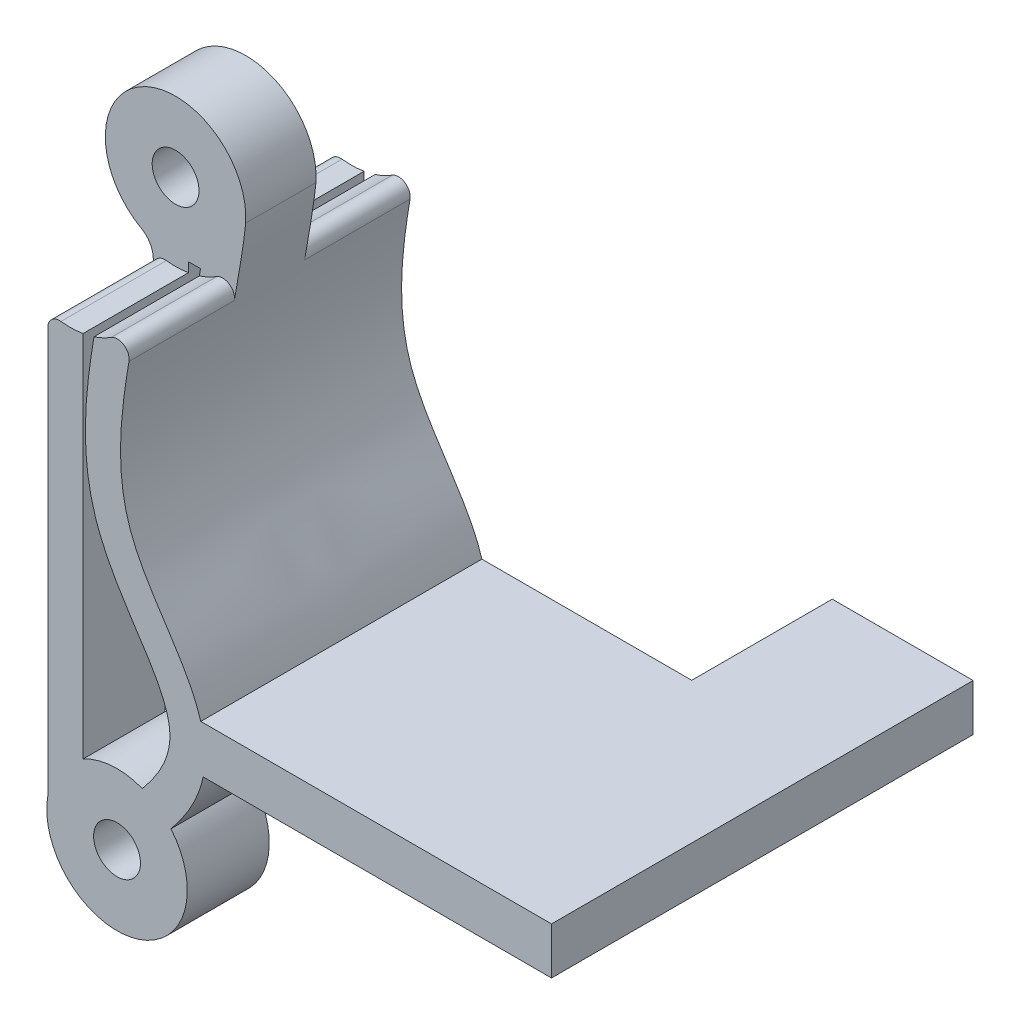
from build123d import *

# Parameters (mm, degrees)
SKETCH1_R               = 1
BOSS_EXTRUDE1_DEPTH     = 12
SKETCH2_R               = 3.3
CUT_EXTRUDE1_DEPTH      = 4.5
CUT_EXTRUDE2_DEPTH      = 2.5
CUT_EXTRUDE2_DEPTH_BACK = 2.5
SKETCH3_R               = 3.3
BOSS_EXTRUDE2_REACH     = 56.558
SKETCH4_W               = 12
SKETCH4_H               = 2
SKETCH5_W               = 6.014002039
SKETCH5_H               = 2
BOSS_EXTRUDE3_DEPTH     = 6
FILLET1_R               = 0.5
FILLET2_R               = 1


with BuildPart() as part:
    # Sketch1 → Boss-Extrude1 (new body)
    with BuildSketch(Plane.XY):
        with BuildLine():
            Line((-2.048815827, 41.884151299), (-2.048815827, 23.656682303))
            ThreePointArc((-2.048815827, 23.656682303), (1.66754925, 20.218418642), (3.205412143, 25.042110601))
            add(Edge.make_bspline(
                [(1.896008332, 44.529660516), (1.616069448, 41.758878479), (-0.936917255, 33.955197005), (6.844694938, 29.417505011), (3.205412143, 25.042110601)],
                knots=[0, 0, 0, 0, 0.461184527, 1, 1, 1, 1], degree=3))
            ThreePointArc((1.896008332, 44.529660516), (-2.768270934, 47.220856283), (-2.048815827, 41.884151299))
        make_face()
        with Locations((-1.097343641, 44.729270045)):
            Circle(SKETCH1_R, mode=Mode.SUBTRACT)
        with Locations((0.902656359, 23.119270045)):
            Circle(SKETCH1_R, mode=Mode.SUBTRACT)
        with BuildLine():
            Line((-0.031319306, 41.884151299), (-0.548815827, 41.884151299))
            Line((-0.548815827, 41.884151299), (-0.548815827, 25.744765902))
            ThreePointArc((-0.548815827, 25.744765902), (0.697826573, 26.112269337), (1.982912704, 25.918028026))
            add(Edge.make_bspline(
                [(-0.031319306, 41.884151299), (-0.050798368, 41.769911378), (-0.110231132, 41.41757497), (-0.243210983, 40.585051968), (-0.402027872, 39.353261852), (-0.479087992, 37.828213551), (-0.375856847, 36.275358456), (0.009969142, 34.681069755), (0.941317901, 32.770668216), (2.035404053, 31.246938586), (2.80471042, 29.909471533), (3.128629571, 29.030940173), (3.19641087, 28.267404516), (3.032335606, 27.550309668), (2.666289508, 26.829120101), (2.334869511, 26.350170873), (2.106769915, 26.067173099), (2.026097439, 25.969974031), (1.996829195, 25.934759382), (1.982912704, 25.918028026)],
                knots=[0.149200089, 0.149200089, 0.149200089, 0.149200089, 0.165683382, 0.19960026, 0.265533433, 0.331466606, 0.397399778, 0.463332951, 0.529266124, 0.661132469, 0.727065642, 0.792998815, 0.858931987, 0.92486516, 0.957831746, 0.990798333, 0.999039979, 1.001358499, 1.00341891, 1.00341891, 1.00341891, 1.00341891], degree=3))
        make_face(mode=Mode.SUBTRACT)
    extrude(amount=BOSS_EXTRUDE1_DEPTH)

    # Sketch2 → Cut-Extrude1 (cut)
    with BuildSketch(Plane.XY.offset(12)):
        with Locations((-1.097343641, 44.729270045)):
            Circle(SKETCH2_R)
    cut_extrude1 = extrude(amount=-CUT_EXTRUDE1_DEPTH, mode=Mode.SUBTRACT)

    # Mirror1: Cut-Extrude1 across plane
    add(cut_extrude1.mirror(Plane.XY.offset(6)), mode=Mode.SUBTRACT)

    # Sketch3 → Cut-Extrude2 (cut, two sides: drawn at the far end of the back side and taken through both)
    with BuildSketch(Plane.XY.offset(6).offset(-CUT_EXTRUDE2_DEPTH_BACK)):
        with Locations((0.902656359, 23.119270045)):
            Circle(SKETCH3_R)
    extrude(amount=CUT_EXTRUDE2_DEPTH + CUT_EXTRUDE2_DEPTH_BACK, mode=Mode.SUBTRACT)

    # Sketch4 → Boss-Extrude2 (add, up to next)
    with BuildSketch(Plane(origin=(19.451184173, 0, 0), x_dir=(0, 0, -1), z_dir=(1, 0, 0)), mode=Mode.PRIVATE) as boss_extrude2_sk1:
        with Locations((-6, 28.648575658)):
            Rectangle(SKETCH4_W, SKETCH4_H)
    boss_extrude2_tool1 = extrude(boss_extrude2_sk1.sketch, amount=-BOSS_EXTRUDE2_REACH, mode=Mode.PRIVATE) - part.part
    add(boss_extrude2_tool1.solids().sort_by_distance((19.451184, 28.648576, 6))[0])

    # Sketch5 → Boss-Extrude3 (add)
    with BuildSketch(Plane(origin=(0, 0, 0), x_dir=(-1, 0, 0), z_dir=(0, 0, -1))):
        with Locations((-16.444183153, 28.648575658)):
            Rectangle(SKETCH5_W, SKETCH5_H)
    extrude(amount=BOSS_EXTRUDE3_DEPTH)

    # Fillet1
    fillet1_edges = [part.edges().sort_by_distance(p)[0] for p in [
        (-2.048815827, 41.569412346, 2.25),
        (-2.048815827, 41.569412346, 9.75),
        (1.670824854, 42.932817101, 2.25),
        (1.670824854, 42.932817101, 9.75),
    ]]
    fillet(fillet1_edges, radius=FILLET1_R)

    # Fillet2
    fillet2_edges = [part.edges().sort_by_distance(p)[0] for p in [
        (-2.048815827, 41.884151299, 6),
    ]]
    fillet(fillet2_edges, radius=FILLET2_R)


solid = part.part
